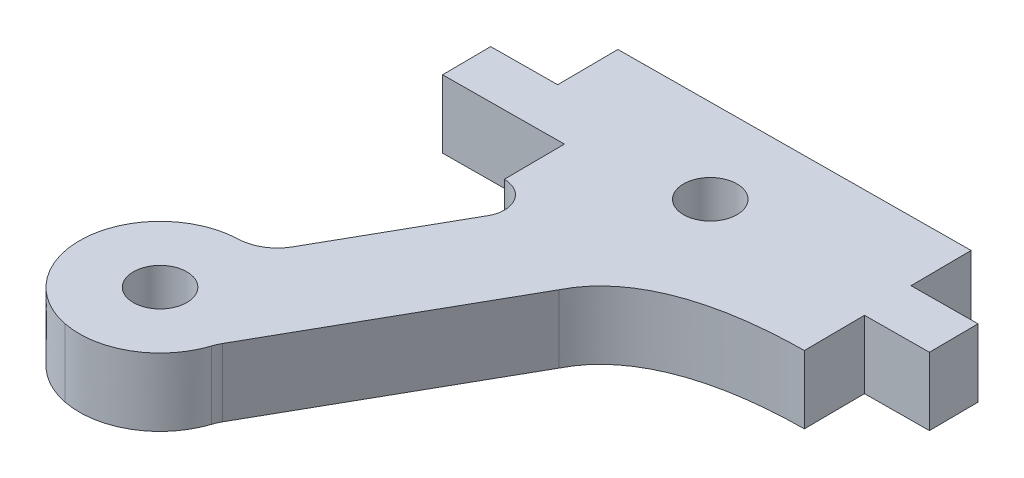
from build123d import *

# Parameters (mm, degrees)
SKETCH1_R           = 1.25
BOSS_EXTRUDE1_DEPTH = 3.175


with BuildPart() as part:
    # Sketch1 → Boss-Extrude1 (new body)
    with BuildSketch(Plane(origin=(0, 0, 0), x_dir=(1, 0, 0), z_dir=(0, 1, 0))):
        with BuildLine():
            Line((-5.444469791, 9.837655139), (-5.441574975, 9.837655139))
            Line((-5.441574975, 9.837655139), (-5.420835273, 7.005029415))
            Line((-5.420835273, 7.005029415), (-5.420846268, 7.002973121))
            Line((-5.420846268, 7.002973121), (-8.531006815, 6.980201386))
            Line((-8.531006815, 6.980201386), (-8.514415699, 4.714189049))
            Line((-8.514415699, 4.714189049), (-2.859532564, 4.75559254))
            Line((-2.859532564, 4.75559254), (-2.838792466, 1.922912831))
            add(Edge.make_bspline(
                [(-2.838792466, 1.922912831), (-2.395360952, 1.92635233), (-1.983961108, 1.692364933), (-1.759440279, 1.309344853)],
                knots=[7, 7, 7, 7, 8, 8, 8, 8], degree=3))
            add(Edge.make_bspline(
                [(-1.759440279, 1.309344853), (-1.53491945, 0.926453869), (-1.531541398, 0.452485309), (-1.750387651, 0.066145605)],
                knots=[8, 8, 8, 8, 9, 9, 9, 9], degree=3))
            Line((-1.750387651, 0.066145605), (-5.052720033, -5.76270746))
            add(Edge.make_bspline(
                [(-5.052720033, -5.76270746), (-5.377436475, -6.335720696), (-5.976621979, -6.697707269), (-6.634081188, -6.718076851)],
                knots=[10, 10, 10, 10, 11, 11, 11, 11], degree=3))
            add(Edge.make_bspline(
                [(-6.634081188, -6.718076851), (-8.547513182, -6.777175382), (-10.113125433, -8.263555542), (-10.274549397, -10.174598623)],
                knots=[11, 11, 11, 11, 12, 12, 12, 12], degree=3))
            add(Edge.make_bspline(
                [(-10.274549397, -10.174598623), (-10.435793873, -12.085697031), (-9.142055014, -13.814474303), (-7.265597507, -14.194949338)],
                knots=[12, 12, 12, 12, 13, 13, 13, 13], degree=3))
            add(Edge.make_bspline(
                [(-7.265597507, -14.194949338), (-5.389259659, -14.57524917), (-3.526139476, -13.486624533), (-2.93328667, -11.662915231)],
                knots=[13, 13, 13, 13, 14, 14, 14, 14], degree=3))
            add(Edge.make_bspline(
                [(-2.93328667, -11.662915231), (-2.89395583, -11.542292999), (-2.842801807, -11.426023163), (-2.780248008, -11.315488899)],
                knots=[14, 14, 14, 14, 15, 15, 15, 15], degree=3))
            Line((-2.780248008, -11.315488899), (2.916197724, -1.261739716))
            add(Edge.make_bspline(
                [(2.916197724, -1.261739716), (4.384872757, 1.659483439), (8.808993905, 1.989076012), (11.110423296, 2.005876999)],
                knots=[16, 16, 16, 16, 17, 17, 17, 17], degree=3))
            Line((11.110423296, 2.005876999), (11.089683137, 4.838565065))
            Line((11.089683137, 4.838565065), (14.105355841, 4.860644987))
            Line((14.105355841, 4.860644987), (14.088607857, 7.148082377))
            Line((14.088607857, 7.148082377), (10.978425183, 7.12531048))
            Line((10.978425183, 7.12531048), (10.957686865, 9.957747195))
            Line((10.957686865, 9.957747195), (-5.444469791, 9.837655139))
        make_face()
        with Locations((2.786936987, 5.93025498)):
            Circle(SKETCH1_R, mode=Mode.SUBTRACT)
        with Locations((-6.51834338, -10.492903186)):
            Circle(SKETCH1_R, mode=Mode.SUBTRACT)
    extrude(amount=BOSS_EXTRUDE1_DEPTH)


solid = part.part
